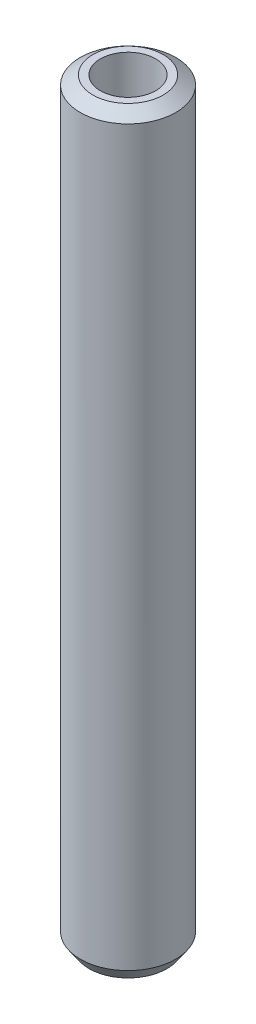
from build123d import *
from OCP.BRepFilletAPI import BRepFilletAPI_MakeChamfer

# Parameters (mm, degrees)
SKETCH1_R           = 12.5
BOSS_EXTRUDE1_DEPTH = 197.476012914
SKETCH2_R           = 7.238941922
CUT_EXTRUDE1_DEPTH  = 199.265669435
CHAMFER1_SIZE       = 2.306375992
CHAMFER1_SIZE2      = 3.31130484


with BuildPart() as part:
    # Sketch1 → Boss-Extrude1 (new body)
    with BuildSketch(Plane(origin=(0, 0, 0), x_dir=(1, 0, 0), z_dir=(0, 1, 0))):
        Circle(SKETCH1_R)
    extrude(amount=BOSS_EXTRUDE1_DEPTH)

    # Sketch2 → Cut-Extrude1 (cut, through all)
    with BuildSketch(Plane(origin=(0, 0, 0), x_dir=(1, 0, 0), z_dir=(0, 1, 0))):
        Circle(SKETCH2_R)
    extrude(amount=CUT_EXTRUDE1_DEPTH, mode=Mode.SUBTRACT)

    # Chamfer1: one chamfer whose edges measure the first distance from different faces: ONE call of the kernel's chamfer builder (chamfer() names one face for all edges)
    chamfer1_edges_1 = [part.edges().sort_by_distance(p)[0] for p in [
        (-12.5, 197.476012914, 0),
    ]]
    chamfer1_side_1 = [part.faces().sort_by_distance(p)[0] for p in [
        (-12.5, 98.738006457, 0),
    ]]
    chamfer1_edges_2 = [part.edges().sort_by_distance(p)[0] for p in [
        (-12.5, 0, 0),
    ]]
    chamfer1_side_2 = [part.faces().sort_by_distance(p)[0] for p in [
        (-12.146446609, 0, 0),
    ]]
    chamfer1 = BRepFilletAPI_MakeChamfer(part.part.solid().wrapped)
    for e in chamfer1_edges_1:
        chamfer1.Add(CHAMFER1_SIZE, CHAMFER1_SIZE2, e.wrapped, chamfer1_side_1[0].wrapped)  # the first distance lies on this face
    for e in chamfer1_edges_2:
        chamfer1.Add(CHAMFER1_SIZE, CHAMFER1_SIZE2, e.wrapped, chamfer1_side_2[0].wrapped)  # the first distance lies on this face
    add(Compound.cast(chamfer1.Shape()), mode=Mode.REPLACE)


solid = part.part
